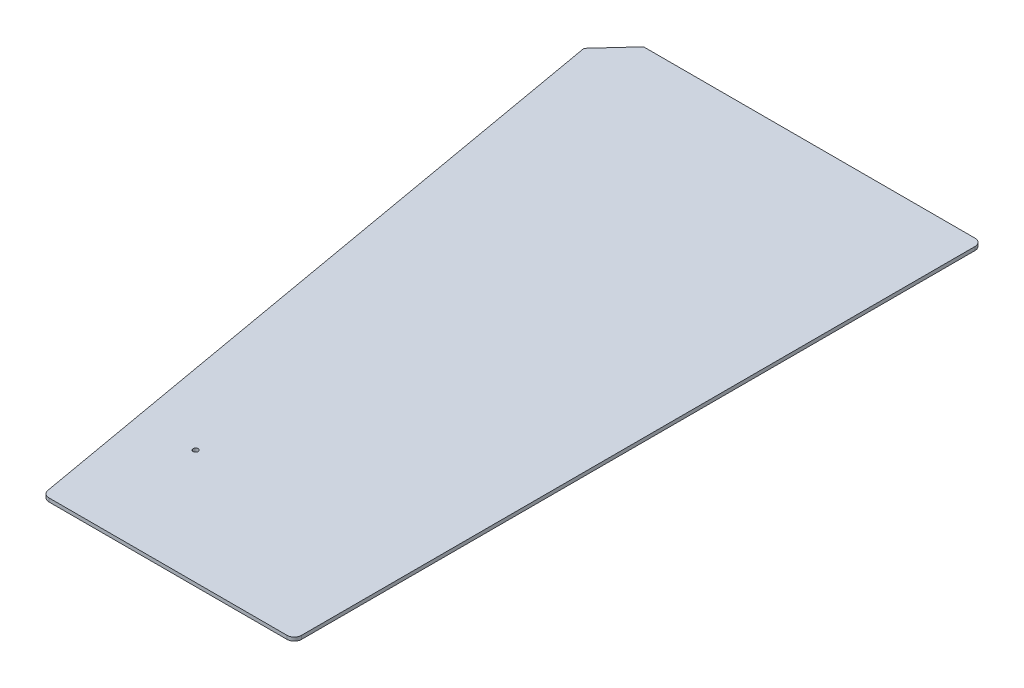
from build123d import *

# Parameters (mm, degrees)
STOCK_TO_SIZE_DEPTH = 3.175
SKETCH2_R           = 2.286
MOUNTING_HOLE_DEPTH = 412.749281684


with BuildPart() as part:
    # Sketch1 → Stock to Size (new body)
    with BuildSketch(Plane(origin=(0, 0, 0), x_dir=(1, 0, 0), z_dir=(0, 1, 0))):
        with BuildLine():
            Line((-84.379130166, -245.545217975), (126.653659737, -245.545217975))
            ThreePointArc((126.653659737, -245.545217975), (131.143787797, -243.685346036), (133.003659737, -239.195217975))
            Line((133.003659737, -239.195217975), (133.003659737, 357.704782025))
            ThreePointArc((133.003659737, 357.704782025), (131.143787797, 362.194910085), (126.653659737, 364.054782025))
            Line((126.653659737, 364.054782025), (-167.051645872, 364.054782025))
            Line((-167.051645872, 364.054782025), (-192.331760318, 336.466378221))
            Line((-192.331760318, 336.466378221), (-90.632659397, -240.297883903))
            ThreePointArc((-90.632659397, -240.297883903), (-88.460831487, -244.059600189), (-84.379130166, -245.545217975))
        make_face()
    extrude(amount=STOCK_TO_SIZE_DEPTH)

    # Sketch2 → Mounting Hole (cut, through all)
    with BuildSketch(Plane(origin=(0, 3.175, 0), x_dir=(1, 0, 0), z_dir=(0, 1, 0))):
        with Locations((-56.03856218, -143.945217975)):
            Circle(SKETCH2_R)
    extrude(amount=-MOUNTING_HOLE_DEPTH, mode=Mode.SUBTRACT)


solid = part.part
